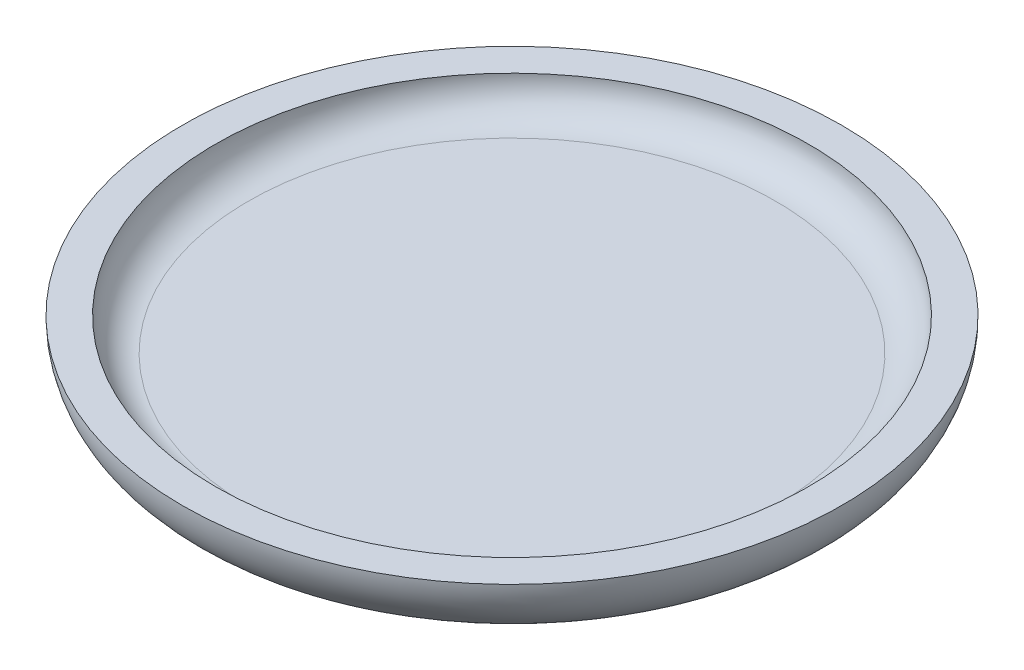
from build123d import *

# Parameters (mm, degrees)
SKETCH1_R           = 63.550998027
BOSS_EXTRUDE1_DEPTH = 12.7
FILLET2_R           = 12.7
SHELL2_T            = -6.35


with BuildPart() as part:
    # Sketch1 → Boss-Extrude1 (new body)
    with BuildSketch(Plane(origin=(0, 0, 0), x_dir=(1, 0, 0), z_dir=(0, 1, 0))):
        with Locations(Location((0, 0, 0), (0, 0, 270))):
            Circle(SKETCH1_R)
    extrude(amount=BOSS_EXTRUDE1_DEPTH)

    # Fillet2
    fillet2_edges = [part.edges().sort_by_distance(p)[0] for p in [
        (0, 0, -63.550998027),
    ]]
    fillet(fillet2_edges, radius=FILLET2_R - 0.0001)  # a hair under: the kernel refuses the full size

    # Shell2
    shell2_openings = [part.faces().sort_by_distance(p)[0] for p in [
        (0, 12.7, 0),
    ]]
    offset(amount=SHELL2_T, openings=shell2_openings)


solid = part.part
